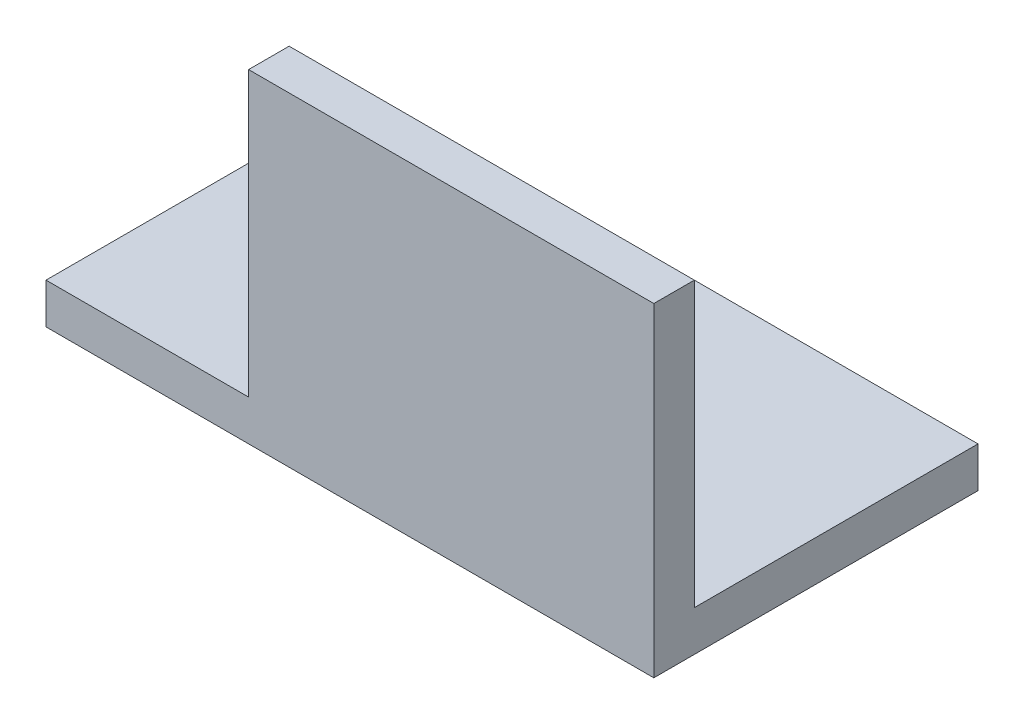
from build123d import *

# Parameters (mm, degrees)
EXTRUDE_1_DEPTH     = 60
SKETCH_2_W          = 20
SKETCH_2_H          = 28
CUT_EXTRUDE_1_DEPTH = 76.153176912


with BuildPart() as part:
    # Эскиз1 → Вытянуть-Тонкостенный1 (new body)
    with BuildSketch(Plane(origin=(0, 0, 0), x_dir=(0, 0, -1), z_dir=(1, 0, 0))):
        Polygon((0, 32), (0, 0), (32, 0), (32, 4), (4, 4), (4, 32), align=None)
    extrude(amount=EXTRUDE_1_DEPTH)

    # Эскиз2 → Вырез-Вытянуть1 (cut, through all)
    with BuildSketch(Plane.XY):
        with Locations((10, 18)):
            Rectangle(SKETCH_2_W, SKETCH_2_H)
    extrude(amount=-CUT_EXTRUDE_1_DEPTH, mode=Mode.SUBTRACT)


solid = part.part
